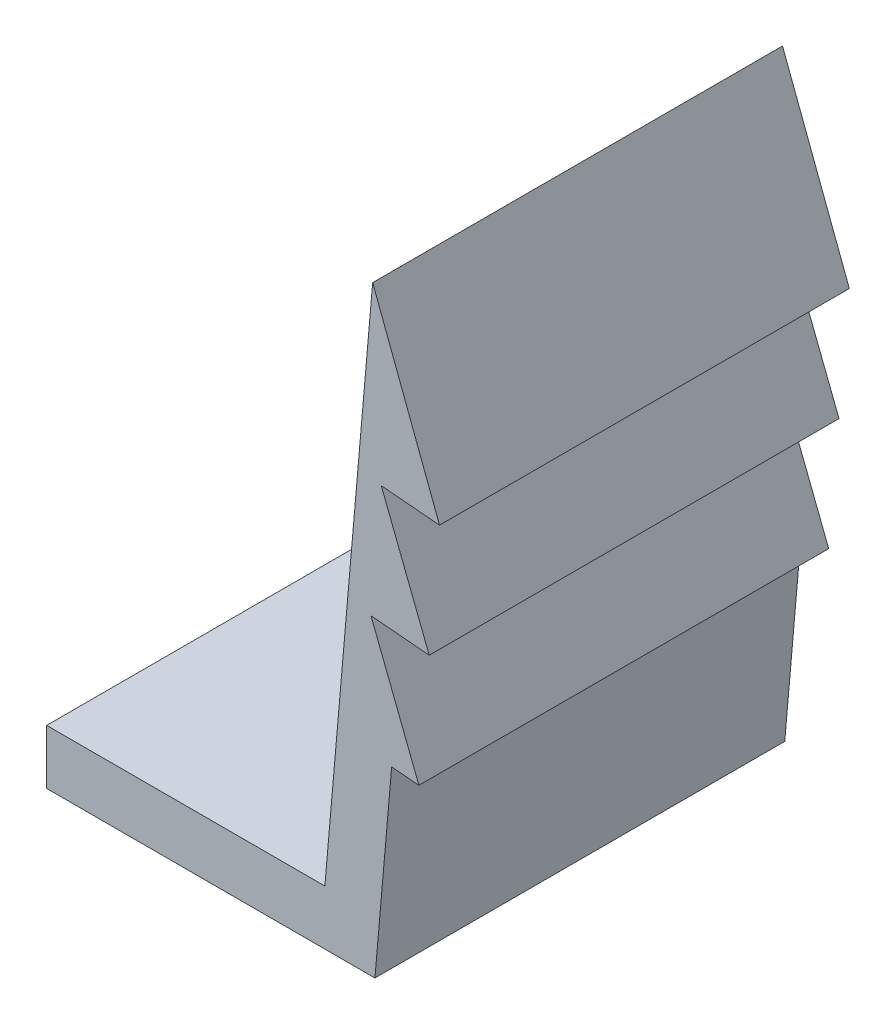
from build123d import *

# Parameters (mm, degrees)
BOSS_EXTRUDE1_DEPTH = 15


with BuildPart() as part:
    # Sketch1 → Boss-Extrude1 (new body)
    with BuildSketch(Plane.XY):
        Polygon((0, 0), (12.014368468, 0), (12.626789113, 7), (13.622983811, 6.912844257), (11.869047714, 11.410339319), (14.000151606, 11.223891887), (12.24621551, 15.721386949), (14.377319402, 15.534939517), (11.931479391, 22), (10.18170612, 2), (0, 2), align=None)
    extrude(amount=BOSS_EXTRUDE1_DEPTH)


solid = part.part
